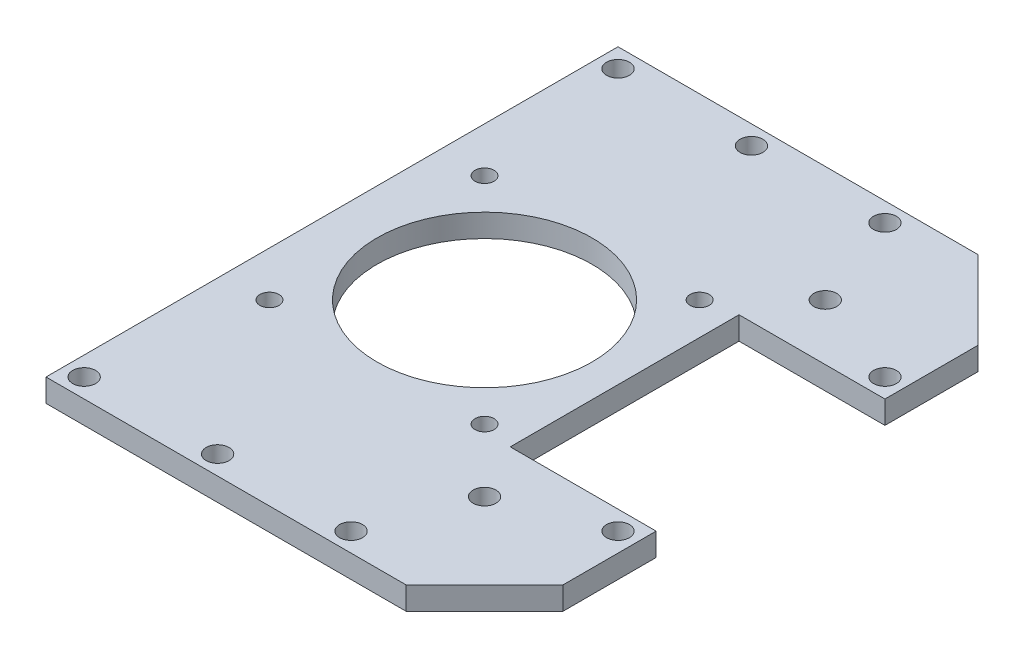
from build123d import *

# Parameters (mm, degrees)
SKETCH_1_R      = 1.5
SKETCH_1_R_2    = 1.25
SKETCH_1_R_3    = 14.1
EXTRUDE_1_DEPTH = 3


with BuildPart() as part:
    # 草图1 → 凸台-拉伸1 (new body)
    with BuildSketch(Plane(origin=(0, 0, 0), x_dir=(1, 0, 0), z_dir=(0, 1, 0))):
        Polygon((37.5, 27.203097622), (37.5, 15), (18.370549784, 15), (18.370549784, -15), (37.5, -15), (37.5, -27.203097622), (27.203097622, -37.5), (-20, -37.5), (-20, 37.5), (27.203097622, 37.5), align=None)
        with Locations((17.5, 35)):
            Circle(SKETCH_1_R, mode=Mode.SUBTRACT)
        with Locations((22.337720199, 22.337720199)):
            Circle(SKETCH_1_R, mode=Mode.SUBTRACT)
        with Locations((35, 17.5)):
            Circle(SKETCH_1_R, mode=Mode.SUBTRACT)
        with Locations((17.5, -35)):
            Circle(SKETCH_1_R, mode=Mode.SUBTRACT)
        with Locations((22.337720199, -22.337720199)):
            Circle(SKETCH_1_R, mode=Mode.SUBTRACT)
        with Locations((35, -17.5)):
            Circle(SKETCH_1_R, mode=Mode.SUBTRACT)
        with Locations((-14.1, 14.1)):
            Circle(SKETCH_1_R_2, mode=Mode.SUBTRACT)
        with Locations((14.1, -14.1)):
            Circle(SKETCH_1_R_2, mode=Mode.SUBTRACT)
        with Locations((0, 35)):
            Circle(SKETCH_1_R, mode=Mode.SUBTRACT)
        with Locations((-17.5, 35)):
            Circle(SKETCH_1_R, mode=Mode.SUBTRACT)
        with Locations((0, -35)):
            Circle(SKETCH_1_R, mode=Mode.SUBTRACT)
        with Locations((-17.5, -35)):
            Circle(SKETCH_1_R, mode=Mode.SUBTRACT)
        with Locations((14.1, 14.1)):
            Circle(SKETCH_1_R_2, mode=Mode.SUBTRACT)
        with Locations((-14.1, -14.1)):
            Circle(SKETCH_1_R_2, mode=Mode.SUBTRACT)
        Circle(SKETCH_1_R_3, mode=Mode.SUBTRACT)
    extrude(amount=EXTRUDE_1_DEPTH)


solid = part.part
